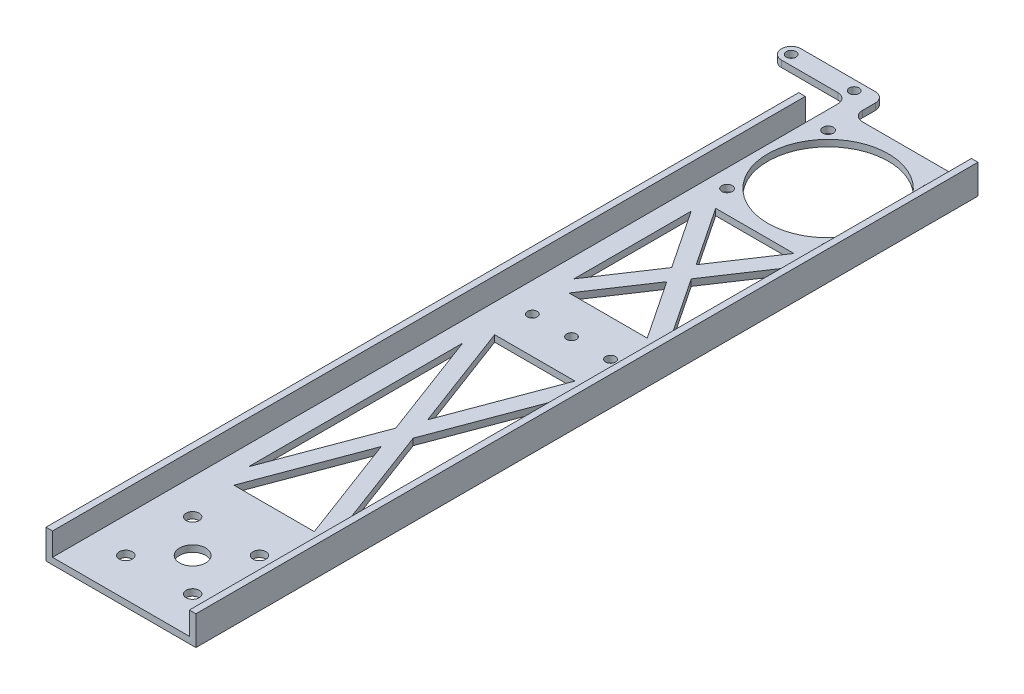
from build123d import *

# Parameters (mm, degrees)
SKETCH_2_W           = 42
SKETCH_2_H           = 46
SKETCH_2_R           = 18.5
EXTRUDE_1_DEPTH      = 2
FILLET_1_R           = 5.5
SKETCH_3_R           = 1.6
CUT_EXTRUDE_1_DEPTH  = 32.208973069
SKETCH_4_R           = 4
SKETCH_4_R_2         = 2
EXTRUDE_2_DEPTH      = 2
SKETCH_7_R           = 1.5
EXTRUDE_4_DEPTH      = 2
EXTRUDE_5_DEPTH      = 7
EXTRUDE_5_DEPTH_BACK = 2
SKETCH_9_W           = 2
SKETCH_9_H           = 231
SKETCH_9_H_2         = 240
SKETCH_12_W          = 30
SKETCH_12_H          = 45
SKETCH_12_H_2        = 80
CUT_EXTRUDE_4_DEPTH  = 222.592303341
EXTRUDE_6_DEPTH      = 2
EXTRUDE_7_DEPTH      = 2
FILLET_2_R           = 3
SKETCH_15_R          = 1.5
CUT_EXTRUDE_5_DEPTH  = 222.592303341


with BuildPart() as part:
    # 草图2 → 凸台-拉伸1 (new body)
    with BuildSketch(Plane(origin=(0, 0, 0), x_dir=(1, 0, 0), z_dir=(0, 1, 0))):
        Rectangle(SKETCH_2_W, SKETCH_2_H)
        with Locations(Location((0, 0, 0), (0, 0, 270))):
            Circle(SKETCH_2_R, mode=Mode.SUBTRACT)
    extrude(amount=EXTRUDE_1_DEPTH)

    # 圆角1
    fillet_1_edges = [part.edges().sort_by_distance(p)[0] for p in [
        (-21, 1, -23),
    ]]
    fillet(fillet_1_edges, radius=FILLET_1_R)

    # 草图3 → 切除-拉伸1 (cut, through all)
    with BuildSketch(Plane(origin=(0, 2, 0), x_dir=(1, 0, 0), z_dir=(0, 1, 0))):
        with Locations(Location((-15.5, 15.5, 0), (0, 0, 270))):
            Circle(SKETCH_3_R)
        with Locations(Location((15.5, 15.5, 0), (0, 0, 270))):
            Circle(SKETCH_3_R)
        with Locations(Location((-15.5, -15.5, 0), (0, 0, 270))):
            Circle(SKETCH_3_R)
        with Locations(Location((15.5, -15.5, 0), (0, 0, 270))):
            Circle(SKETCH_3_R)
    extrude(amount=-CUT_EXTRUDE_1_DEPTH, mode=Mode.SUBTRACT)

    # 草图4 → 凸台-拉伸2 (add)
    with BuildSketch(Plane(origin=(0, 2, 0), x_dir=(1, 0, 0), z_dir=(0, 1, 0))):
        Polygon((-21, -23), (21, -23), (21, -176), (21, -217), (-21, -217), (-21, -176), align=None)
        with Locations(Location((0, -195, 0), (0, 0, 270))):
            Circle(SKETCH_4_R, mode=Mode.SUBTRACT)
        with Locations(Location((10.253048327, -184.746951673, 0), (0, 0, 270))):
            Circle(SKETCH_4_R_2, mode=Mode.SUBTRACT)
        with Locations(Location((-10.253048327, -184.746951673, 0), (0, 0, 270))):
            Circle(SKETCH_4_R_2, mode=Mode.SUBTRACT)
        with Locations(Location((10.253048327, -205.253048327, 0), (0, 0, 270))):
            Circle(SKETCH_4_R_2, mode=Mode.SUBTRACT)
        with Locations(Location((-10.253048327, -205.253048327, 0), (0, 0, 270))):
            Circle(SKETCH_4_R_2, mode=Mode.SUBTRACT)
    extrude(amount=-EXTRUDE_2_DEPTH)

    # 草图7 → 凸台-拉伸4 (add)
    with BuildSketch(Plane(origin=(0, 2, 0), x_dir=(1, 0, 0), z_dir=(0, 1, 0))):
        Polygon((-15.5, 23), (-21, 17), (-21, 27), (-41.33, 27), (-44.33, 27), (-44.33, 33), (-41.33, 33), (-15.5, 33), align=None)
        with Locations(Location((-41.33, 30, 0), (0, 0, 270))):
            Circle(SKETCH_7_R, mode=Mode.SUBTRACT)
        with Locations(Location((-22, 30, 0), (0, 0, 270))):
            Circle(SKETCH_7_R, mode=Mode.SUBTRACT)
    extrude(amount=-EXTRUDE_4_DEPTH)

    # 草图9 → 凸台-拉伸5 (add, two sides: drawn at the far end of the back side and taken through both)
    with BuildSketch(Plane(origin=(0, 2, 0), x_dir=(1, 0, 0), z_dir=(0, 1, 0)).offset(-EXTRUDE_5_DEPTH_BACK)):
        with Locations((-22, -101.5)):
            Rectangle(SKETCH_9_W, SKETCH_9_H)
        with Locations((22, -97)):
            Rectangle(SKETCH_9_W, SKETCH_9_H_2)
    extrude(amount=EXTRUDE_5_DEPTH + EXTRUDE_5_DEPTH_BACK)

    # 草图12 → 切除-拉伸4 (cut, through all)
    with BuildSketch(Plane(origin=(0, 2, 0), x_dir=(1, 0, 0), z_dir=(0, 1, 0))):
        with Locations((0, -45)):
            Rectangle(SKETCH_12_W, SKETCH_12_H)
        with Locations((0, -130)):
            Rectangle(SKETCH_12_W, SKETCH_12_H_2)
    extrude(amount=-CUT_EXTRUDE_4_DEPTH, mode=Mode.SUBTRACT)

    # 草图13 → 凸台-拉伸6 (add)
    with BuildSketch(Plane(origin=(0, 2, 0), x_dir=(1, 0, 0), z_dir=(0, 1, 0))):
        Polygon((-17.080125736, -23.886750491), (12.919874264, -68.886750491), (17.080125736, -66.113249509), (-12.919874264, -21.113249509), align=None)
        Polygon((-17.340822944, -90.877808604), (12.659177056, -170.877808604), (17.340822944, -169.122191396), (-12.659177056, -89.122191396), align=None)
    extrude(amount=-EXTRUDE_6_DEPTH)

    # 草图14 → 凸台-拉伸7 (add)
    with BuildSketch(Plane(origin=(0, 2, 0), x_dir=(1, 0, 0), z_dir=(0, 1, 0))):
        Polygon((-17.080125736, -66.113249509), (12.919874264, -21.113249509), (17.080125736, -23.886750491), (-12.919874264, -68.886750491), align=None)
        Polygon((-17.340822944, -169.122191396), (12.659177056, -89.122191396), (17.340822944, -90.877808604), (-12.659177056, -170.877808604), align=None)
    extrude(amount=-EXTRUDE_7_DEPTH)

    # 圆角2
    fillet_2_edges = [part.edges().sort_by_distance(p)[0] for p in [
        (-15.5, 1, -23),
        (-15.5, 1, -33),
        (-21, 1, -27),
        (-44.33, 1, -27),
        (-44.33, 1, -33),
    ]]
    fillet(fillet_2_edges, radius=FILLET_2_R - 0.0001)  # a hair under: the kernel refuses the full size

    # 草图15 → 切除-拉伸5 (cut, through all)
    with BuildSketch(Plane(origin=(0, 2, 0), x_dir=(1, 0, 0), z_dir=(0, 1, 0))):
        with Locations(Location((0, -78.75, 0), (0, 0, 270))):
            Circle(SKETCH_15_R)
        with Locations(Location((12, -78.75, 0), (0, 0, 270))):
            Circle(SKETCH_15_R)
        with Locations(Location((-12, -78.75, 0), (0, 0, 270))):
            Circle(SKETCH_15_R)
    extrude(amount=-CUT_EXTRUDE_5_DEPTH, mode=Mode.SUBTRACT)


solid = part.part
